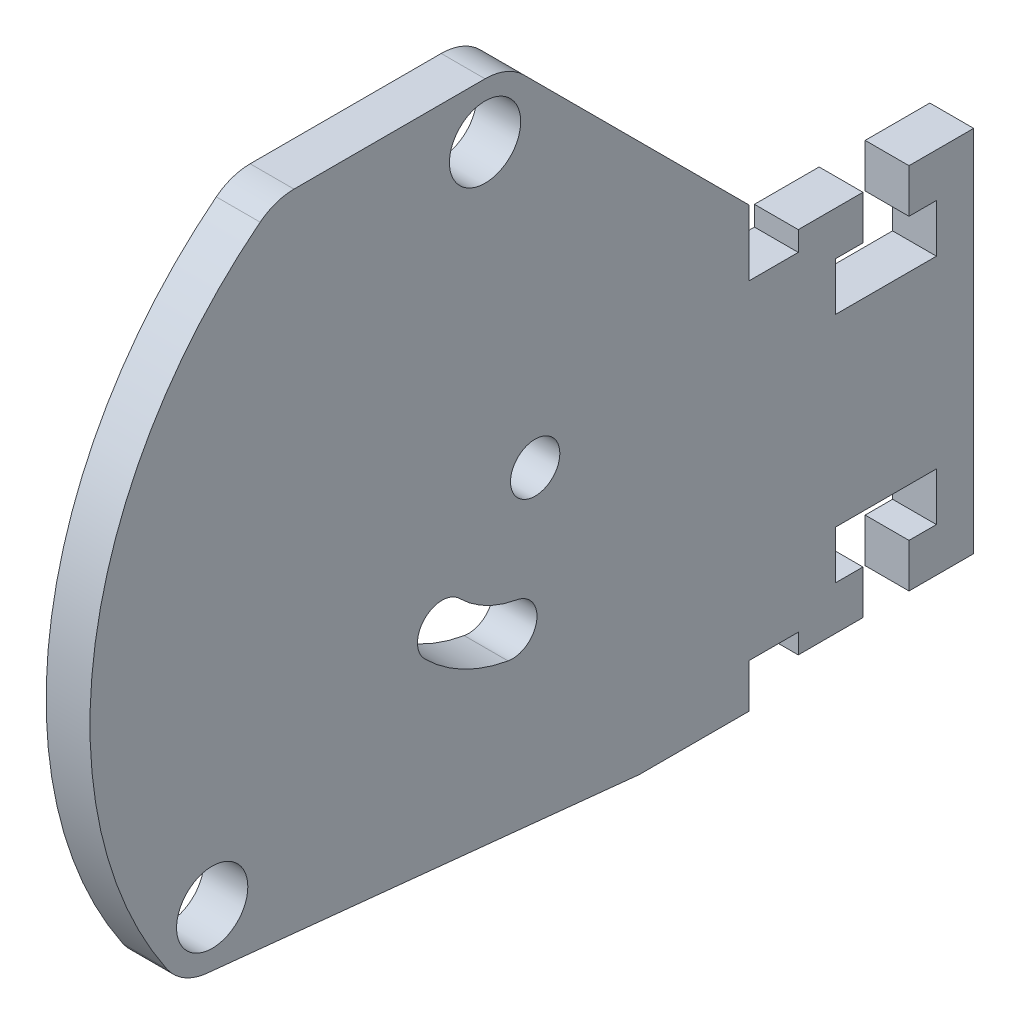
from build123d import *

# Parameters (mm, degrees)
SKETCH1_R        = 1.625
SKETCH1_R_2      = 1.125
BASE_SHAPE_DEPTH = 2


with BuildPart() as part:
    # Sketch1 → Base shape (new body)
    with BuildSketch(Plane(origin=(0, 0, 0), x_dir=(0, 0, -1), z_dir=(1, 0, 0))):
        with BuildLine():
            Line((12, 15), (9.75, 15))
            Line((9.75, 15), (9.75, 18))
            Line((9.75, 18), (-0.517766948, 28.267766948))
            ThreePointArc((-0.517766948, 28.267766948), (-1.328825322, 28.80969883), (-2.285533906, 29))
            Line((-2.285533906, 29), (-10.999104368, 29))
            ThreePointArc((-10.999104368, 29), (-11.816220583, 28.862693618), (-12.543580579, 28.465856891))
            ThreePointArc((-12.543580579, 28.465856891), (-20.062935545, 15.619073149), (-16.798648728, 1.095816517))
            ThreePointArc((-16.798648728, 1.095816517), (-15.900623112, 0.290875886), (-14.7302511, 0))
            Line((-14.7302511, 0), (-14.857423892, 0))
            Line((-14.857423892, 0), (4.75, -2))
            Line((4.75, -2), (9.75, -2))
            Line((9.75, -2), (9.75, 0))
            Line((9.75, 0), (12, 0))
            Line((12, 0), (12, -0.9))
            Line((12, -0.9), (14.95, -0.9))
            Line((14.95, -0.9), (14.95, 1.1))
            Line((14.95, 1.1), (13.7, 1.1))
            Line((13.7, 1.1), (13.7, 3.3))
            Line((13.7, 3.3), (18.3, 3.3))
            Line((18.3, 3.3), (18.3, 1.1))
            Line((18.3, 1.1), (17.05, 1.1))
            Line((17.05, 1.1), (17.05, -0.9))
            Line((17.05, -0.9), (20, -0.9))
            Line((20, -0.9), (20, 15.9))
            Line((20, 15.9), (17.05, 15.9))
            Line((17.05, 15.9), (17.05, 13.9))
            Line((17.05, 13.9), (18.3, 13.9))
            Line((18.3, 13.9), (18.3, 11.7))
            Line((18.3, 11.7), (13.7, 11.7))
            Line((13.7, 11.7), (13.7, 13.9))
            Line((13.7, 13.9), (14.95, 13.9))
            Line((14.95, 13.9), (14.95, 15.9))
            Line((14.95, 15.9), (12, 15.9))
            Line((12, 15.9), (12, 15))
        make_face()
        with BuildLine():
            ThreePointArc((-1.237243222, 5.483244752), (-3.28995885, 6.180047803), (-5.038135816, 7.461864184))
            ThreePointArc((-5.038135816, 7.461864184), (-5.038135819, 9.052854439), (-3.447145564, 9.052854448))
            ThreePointArc((-3.447145564, 9.052854448), (-2.251024497, 8.175822192), (-0.846534874, 7.699062205))
            ThreePointArc((-0.846534874, 7.699062205), (0.066019661, 6.395799308), (-1.237243222, 5.483244752))
        make_face(mode=Mode.SUBTRACT)
        with Locations((-14.7302511, 2.5)):
            Circle(SKETCH1_R, mode=Mode.SUBTRACT)
        with Locations((-2.285533906, 26.5)):
            Circle(SKETCH1_R, mode=Mode.SUBTRACT)
        with Locations((0, 12.5)):
            Circle(SKETCH1_R_2, mode=Mode.SUBTRACT)
    extrude(amount=BASE_SHAPE_DEPTH)


solid = part.part
